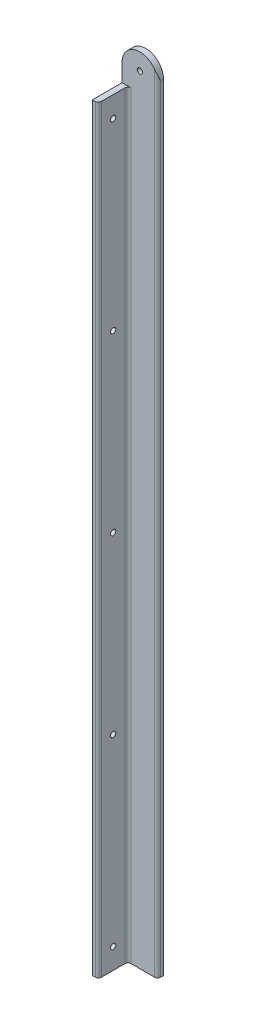
from build123d import *

# Parameters (mm, degrees)
BOSS_EXTRUDE1_DEPTH = 431.8
SKETCH4_W           = 15.875
SKETCH4_H           = 25.4
CUT_EXTRUDE1_DEPTH  = 6.35
SKETCH5_W           = 1.5875
SKETCH5_H           = 25.4
CUT_EXTRUDE2_DEPTH  = 6.35
SKETCH6_R           = 1.4224
CUT_EXTRUDE3_DEPTH  = 5.08
CUT_EXTRUDE4_START  = -6.35
CUT_EXTRUDE4_DEPTH  = 6.35
SKETCH8_R           = 1.4224
CUT_EXTRUDE5_DEPTH  = 5.08
SKETCH9_W           = 28.861002292
SKETCH9_H           = 547.524656259
CUT_EXTRUDE6_DEPTH  = 30.48
CUT_EXTRUDE7_DEPTH  = 5.08


with BuildPart() as part:
    # Sketch2 → Boss-Extrude1 (new body)
    with BuildSketch(Plane(origin=(0, 0, 0), x_dir=(1, 0, 0), z_dir=(0, 1, 0))):
        with BuildLine():
            Line((0, 0), (19.05, 0))
            Line((19.05, 0), (19.05, 1.5875))
            ThreePointArc((19.05, 1.5875), (18.585032015, 2.710032015), (17.4625, 3.175))
            Line((17.4625, 3.175), (4.7625, 3.175))
            ThreePointArc((4.7625, 3.175), (3.639967985, 3.639967985), (3.175, 4.7625))
            Line((3.175, 4.7625), (3.175, 17.4625))
            ThreePointArc((3.175, 17.4625), (2.710032015, 18.585032015), (1.5875, 19.05))
            Line((1.5875, 19.05), (0, 19.05))
            Line((0, 19.05), (0, 0))
        make_face()
    extrude(amount=BOSS_EXTRUDE1_DEPTH)

    # Sketch4 → Cut-Extrude1 (cut)
    with BuildSketch(Plane(origin=(3.175, 0, 0), x_dir=(0, 0, -1), z_dir=(1, 0, 0))):
        with Locations((11.1125, 419.1)):
            Rectangle(SKETCH4_W, SKETCH4_H)
    extrude(amount=-CUT_EXTRUDE1_DEPTH, mode=Mode.SUBTRACT)

    # Sketch5 → Cut-Extrude2 (cut)
    with BuildSketch(Plane.ZY.offset(-3.175)):
        with Locations((-3.96875, 419.1)):
            Rectangle(SKETCH5_W, SKETCH5_H)
    extrude(amount=-CUT_EXTRUDE2_DEPTH, mode=Mode.SUBTRACT)

    # Sketch6 → Cut-Extrude3 (cut)
    with BuildSketch(Plane(origin=(3.175, 0, 0), x_dir=(0, 0, -1), z_dir=(1, 0, 0))):
        with Locations((11.1125, 109.5375)):
            Circle(SKETCH6_R)
        with Locations((11.1125, 203.2)):
            Circle(SKETCH6_R)
        with Locations((11.1125, 296.8625)):
            Circle(SKETCH6_R)
        with Locations((11.1125, 11.1125)):
            Circle(SKETCH6_R)
        with Locations((11.1125, 395.2875)):
            Circle(SKETCH6_R)
    extrude(amount=-CUT_EXTRUDE3_DEPTH, mode=Mode.SUBTRACT)

    # Sketch7 → Cut-Extrude4 (cut)
    with BuildSketch(Plane(origin=(0, 431.8, 0), x_dir=(1, 0, 0), z_dir=(0, 1, 0)).offset(CUT_EXTRUDE4_START)):
        with BuildLine():
            Line((17.4625, 3.175), (0, 3.175))
            Line((0, 3.175), (0, 0))
            Line((0, 0), (19.05, 0))
            Line((19.05, 0), (19.05, 1.5875))
            ThreePointArc((19.05, 1.5875), (18.585032015, 2.710032015), (17.4625, 3.175))
        make_face()
    extrude(amount=CUT_EXTRUDE4_DEPTH, mode=Mode.SUBTRACT)

    # Sketch8 → Cut-Extrude5 (cut)
    with BuildSketch(Plane(origin=(0, 0, -3.175), x_dir=(-1, 0, 0), z_dir=(0, 0, -1))):
        with Locations((-9.525, 416.56)):
            Circle(SKETCH8_R)
    extrude(amount=-CUT_EXTRUDE5_DEPTH, mode=Mode.SUBTRACT)


with BuildPart() as body_2:
    # Mirror3: mirrored copy
    add(part.part.mirror(Plane.XY.offset(2.54)))

    # Sketch10 → Cut-Extrude7 (cut)
    with BuildSketch(Plane.XY.offset(8.255)):
        with BuildLine():
            Line((19.05, 415.925), (19.05, 425.45))
            Line((19.05, 425.45), (9.525, 425.45))
            ThreePointArc((9.525, 425.45), (16.260192091, 422.660192091), (19.05, 415.925))
        make_face()
        with BuildLine():
            ThreePointArc((0, 415.925), (2.789807909, 422.660192091), (9.525, 425.45))
            Line((9.525, 425.45), (0, 425.45))
            Line((0, 425.45), (0, 415.925))
        make_face()
    extrude(amount=-CUT_EXTRUDE7_DEPTH, mode=Mode.SUBTRACT)


with BuildPart() as part_1:
    add(part.part)

    # Sketch9 → Cut-Extrude6 (cut)
    with BuildSketch(Plane.XY.offset(2.54)):
        with Locations((7.805746781, 195.778589833)):
            Rectangle(SKETCH9_W, SKETCH9_H)
    extrude(amount=-CUT_EXTRUDE6_DEPTH, mode=Mode.SUBTRACT)


solid = body_2.part
